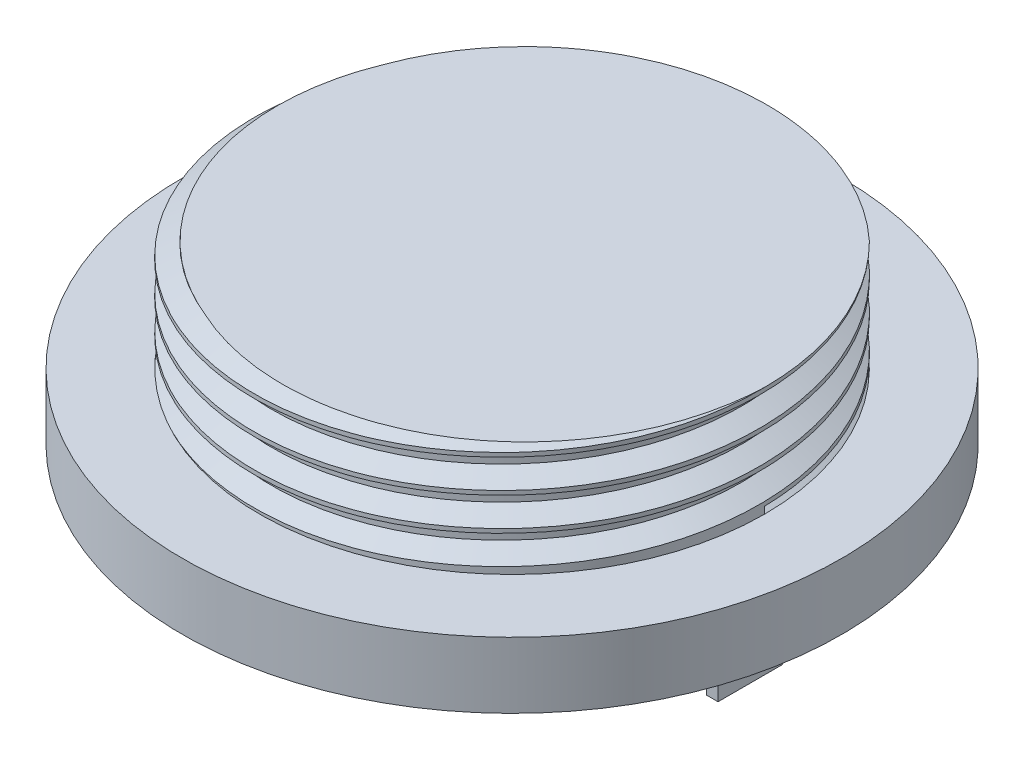
from build123d import *

# Parameters (mm, degrees)
ROSCA1_PITCH            = 1.5
SALIENTE_EXTRUIR1_DEPTH = 2


with BuildPart() as part:
    # Croquis1 → Revolución1 (revolve)
    with BuildSketch(Plane.XY, mode=Mode.PRIVATE) as revoluci_n1_sk:
        Polygon((0, 0), (-11.5, 0), (-11.5, -5), (-15, -5), (-15, -8), (0, -8), align=None)
    revolve(revoluci_n1_sk.sketch.rotate(Axis((0, -8, 0), (0, 1, 0)), 270), axis=Axis((0, -8, 0), (0, 1, 0)))

    # Rosca1: arcs per turn and ends read off the stored shape
    # Rosca1: the profile of Perfil de rosca1 profile screwed along a right-hand helix through 4 turns, 8 arcs to a turn; built about Z, then put on its axis
    rosca1_z = Axis((0, 0, 0), (0, 0, 1))
    rosca1_corners = [(11.5003, 0, -6.000173205), (11.5003, 0, -4.687326799), (10.688101187, 0, -5.156250002), (10.688101187, 0, -5.531250002)]
    with BuildLine(mode=Mode.PRIVATE) as rosca1_profile:
        Line(rosca1_corners[0], rosca1_corners[1])
        Line(rosca1_corners[1], rosca1_corners[2])
        Line(rosca1_corners[2], rosca1_corners[3])
        Line(rosca1_corners[3], rosca1_corners[0])
    rosca1_cap = Face(rosca1_profile.wire())
    rosca1_turn_angles = [0, 22.5, 45, 67.5, 90, 112.5, 135, 157.5, 180, 202.5, 225, 247.5, 270, 292.5, 315, 337.5, 360]
    rosca1_turn_weights = [1, 0.9238795325112867, 1, 0.9238795325112867, 1, 0.9238795325112867, 1, 0.9238795325112867, 1, 0.9238795325112867, 1, 0.9238795325112867, 1, 0.9238795325112867, 1, 0.9238795325112867, 1]
    rosca1_turn_rails = [Edge.make_bspline([Vector(p[0], p[1], 0).rotate(rosca1_z, rosca1_turn_angles[k]) / rosca1_turn_weights[k] + Vector(0, 0, p[2] + ROSCA1_PITCH * rosca1_turn_angles[k] / 360) for k in range(17)], [0, 0, 0, 1, 1, 2, 2, 3, 3, 4, 4, 5, 5, 6, 6, 7, 7, 8, 8, 8], 2, rosca1_turn_weights) for p in rosca1_corners]
    rosca1_turn_sides = [Face.make_surface_from_curves(rosca1_turn_rails[p[0]], rosca1_turn_rails[p[1]]) for p in [(0, 1), (1, 2), (2, 3), (3, 0)]]
    rosca1 = Plane(origin=(0, 0, 0), x_dir=(1, 0, 0), z_dir=(0, 1, 0)) * Solid(Shell([*[p.moved(Location((0, 0, ROSCA1_PITCH * i))) for i in range(4) for p in rosca1_turn_sides], rosca1_cap, rosca1_cap.rotate(rosca1_z, 1440).moved(Location((0, 0, ROSCA1_PITCH * 1440 / 360)))]))
    add(rosca1, mode=Mode.SUBTRACT)

    # Croquis4 → Saliente-Extruir1 (add)
    # profile 1 of 3: a face of its own
    with BuildSketch(Plane.XZ.offset(8)):
        with BuildLine():
            add(Edge.make_bspline(
                [(10.956503842, -6.005254355), (10.58780086, -6.199308556), (9.811856709, -5.768563764), (9.002753455, -5.571617792), (8.393819812, -5.354219577), (7.935493903, -5.19363361), (7.52067907, -5.165999151), (7.171987553, -5.159040487), (6.883861732, -5.498925025), (5.561331494, -6.348982973), (1.697830119, -7.917262619), (-3.462876257, -6.598952384), (-6.28590036, -3.209042971), (-8.240882907, 0.240350895), (-9.613556819, 3.229288355), (-10.599345379, 5.162346026)],
                knots=[0, 0, 0, 0, 0.045509031, 0.074889424, 0.092461381, 0.113663555, 0.12569481, 0.137175213, 0.14804311, 0.170270934, 0.305000949, 0.581101451, 0.650983707, 0.770099509, 1, 1, 1, 1], degree=3))
            add(Edge.make_bspline(
                [(-10.599345379, 5.162346026), (-9.231465535, 5.432474329), (-6.530023702, 5.508022369), (-1.060981598, 5.441982477), (4.575223582, 3.094614921), (7.36718164, -1.31970594), (8.055587124, -3.43828837), (7.794686735, -4.49416496), (8.203849604, -4.605717994), (8.565000776, -4.772953933), (9.118436531, -4.951296251), (9.913358399, -5.234957011), (11.011511279, -5.409340456), (10.956503842, -6.005254355)],
                knots=[0, 0, 0, 0, 0.154784951, 0.300688181, 0.611266062, 0.783841375, 0.856255033, 0.872092857, 0.881127578, 0.897547223, 0.918952342, 0.943746115, 1, 1, 1, 1], degree=3))
        make_face()
        with BuildLine():
            Line((7.003886937, -3.927477776), (5.613399008, -3.493767591))
            add(Edge.make_bspline(
                [(5.517503289, 0.126295811), (5.423569529, -0.521986953), (5.576388101, -1.726854958), (5.529476646, -2.937152341), (5.613399008, -3.493767591)],
                knots=[0, 0, 0, 0, 0.536589435, 1, 1, 1, 1], degree=3))
            add(Edge.make_bspline(
                [(7.003886937, -3.927477776), (7.089540708, -3.348044041), (6.958094789, -2.467698269), (6.335157535, -1.130677768), (5.853297578, -0.380433266), (5.517503289, 0.126295811)],
                knots=[0, 0, 0, 0, 0.395874286, 0.586576357, 1, 1, 1, 1], degree=3))
        make_face(mode=Mode.SUBTRACT)
        with BuildLine():
            add(Edge.make_bspline(
                [(6.394804764, -4.870429225), (5.937473497, -5.408955307), (4.623914586, -6.002734091), (3.274589993, -6.499184457), (2.519154827, -6.473045757)],
                knots=[0, 0, 0, 0, 0.481114359, 1, 1, 1, 1], degree=3))
            add(Edge.make_bspline(
                [(5.585334198, -4.509280819), (5.248197612, -4.699406888), (4.771244217, -5.073427234), (3.699926502, -5.650516611), (2.939367297, -6.009678765), (2.519154827, -6.473045757)],
                knots=[0, 0, 0, 0, 0.317739101, 0.494985422, 1, 1, 1, 1], degree=3))
            Line((5.585334198, -4.509280819), (6.394804764, -4.870429225))
        make_face(mode=Mode.SUBTRACT)
        with BuildLine():
            add(Edge.make_bspline(
                [(4.665250672, -4.114718742), (4.408888184, -4.475500518), (3.817963383, -4.838480602), (3.002108543, -5.411863739), (2.151126658, -5.800655772), (1.660574333, -6.271629973), (1.314871031, -6.40095856)],
                knots=[0, 0, 0, 0, 0.316444487, 0.507915907, 0.734242178, 1, 1, 1, 1], degree=3))
            add(Edge.make_bspline(
                [(1.314871031, -6.40095856), (0.550038283, -6.563786531), (-0.244892778, -6.432908819), (-0.975913201, -6.189294125)],
                knots=[0, 0, 0, 0, 1, 1, 1, 1], degree=3))
            add(Edge.make_bspline(
                [(-0.975913201, -6.189294125), (-0.62368355, -5.818841998), (0.024224486, -5.311361734), (0.976061635, -4.659200322), (1.862581632, -4.089766365), (2.4336117, -3.610841442), (2.787150335, -3.404318239)],
                knots=[0, 0, 0, 0, 0.326234019, 0.524999997, 0.738479425, 1, 1, 1, 1], degree=3))
            add(Edge.make_bspline(
                [(4.665250672, -4.114718742), (4.342359182, -4.033879717), (3.722526491, -3.778622151), (3.105298876, -3.519289948), (2.787150335, -3.404318239)],
                knots=[0, 0, 0, 0, 0.495129296, 1, 1, 1, 1], degree=3))
        make_face(mode=Mode.SUBTRACT)
        with BuildLine():
            add(Edge.make_bspline(
                [(4.892612697, -2.935865733), (4.320350004, -2.771645266), (3.770298155, -2.53986535), (3.229863692, -2.292387016)],
                knots=[0, 0, 0, 0, 1, 1, 1, 1], degree=3))
            add(Edge.make_bspline(
                [(3.229863692, -2.292387016), (3.242137772, -1.640703688), (2.968904192, -0.628895781), (2.882262515, 0.961647448), (2.761202132, 1.900636655), (2.787150335, 2.453912)],
                knots=[0, 0, 0, 0, 0.405945984, 0.652935856, 1, 1, 1, 1], degree=3))
            add(Edge.make_bspline(
                [(4.665250672, 0.744832528), (4.58798513, 1.10640377), (4.182603531, 1.484190036), (3.58669641, 2.132870374), (3.062036608, 2.294848511), (2.787150335, 2.453912)],
                knots=[0, 0, 0, 0, 0.397172812, 0.631474775, 1, 1, 1, 1], degree=3))
            add(Edge.make_bspline(
                [(4.892612697, -2.935865733), (4.859433459, -2.393835483), (4.801497202, -1.165918161), (4.727422279, 0.061280836), (4.665250672, 0.744832528)],
                knots=[0, 0, 0, 0, 0.44173337, 1, 1, 1, 1], degree=3))
        make_face(mode=Mode.SUBTRACT)
        with BuildLine():
            add(Edge.make_bspline(
                [(1.788471367, -2.935865733), (1.387401336, -3.250366602), (0.704365968, -3.759328134), (-0.144398574, -4.492781649), (-1.043372036, -4.977218913), (-1.495695001, -5.490313901), (-1.832225154, -5.715946469)],
                knots=[0, 0, 0, 0, 0.33454946, 0.559859208, 0.734193862, 1, 1, 1, 1], degree=3))
            add(Edge.make_bspline(
                [(-1.832225154, -5.715946469), (-2.279845826, -5.694800756), (-2.850192732, -5.213074007), (-3.52751923, -4.911084354), (-3.747118863, -4.675832183)],
                knots=[0, 0, 0, 0, 0.568617713, 1, 1, 1, 1], degree=3))
            add(Edge.make_bspline(
                [(-3.747118863, -4.675832183), (-3.406152545, -4.339296813), (-2.400899121, -3.22668591), (-1.106142243, -2.433864849), (-0.416783215, -1.685422272)],
                knots=[0, 0, 0, 0, 0.321357801, 1, 1, 1, 1], degree=3))
            add(Edge.make_bspline(
                [(1.788471367, -2.935865733), (1.432466447, -2.72877212), (0.607454899, -2.474202104), (-0.046274277, -1.908808413), (-0.416783215, -1.685422272)],
                knots=[0, 0, 0, 0, 0.486655124, 1, 1, 1, 1], degree=3))
        make_face(mode=Mode.SUBTRACT)
        with BuildLine():
            add(Edge.make_bspline(
                [(-1.473216958, -1.225024265), (-1.674758499, -1.685859799), (-2.285817388, -2.186022673), (-3.408170939, -3.002658892), (-3.874149464, -3.812653434), (-4.4185876, -4.114718742)],
                knots=[0, 0, 0, 0, 0.35060217, 0.56402103, 1, 1, 1, 1], degree=3))
            add(Edge.make_bspline(
                [(-4.4185876, -4.114718742), (-4.825691243, -3.849422749), (-5.216581624, -3.078537455), (-5.812789126, -2.465852802), (-6.013996697, -2.137062824)],
                knots=[0, 0, 0, 0, 0.548238925, 1, 1, 1, 1], degree=3))
            add(Edge.make_bspline(
                [(-6.013996697, -2.137062824), (-5.553192818, -1.842411561), (-4.906071037, -1.427666947), (-3.994891815, -0.733073295), (-3.45139975, -0.461876116), (-3.191349833, -0.181776825)],
                knots=[0, 0, 0, 0, 0.477747976, 0.669719662, 1, 1, 1, 1], degree=3))
            add(Edge.make_bspline(
                [(-1.473216958, -1.225024265), (-1.997361496, -0.791750417), (-2.698147633, -0.65860339), (-3.191349833, -0.181776825)],
                knots=[0, 0, 0, 0, 1, 1, 1, 1], degree=3))
        make_face(mode=Mode.SUBTRACT)
        with BuildLine():
            add(Edge.make_bspline(
                [(-6.389619307, -1.503524143), (-5.930624402, -1.05253252), (-5.043745097, -0.702057406), (-4.167478991, -0.086393925), (-4.043624248, 0.280881365)],
                knots=[0, 0, 0, 0, 0.616736789, 1, 1, 1, 1], degree=3))
            add(Edge.make_bspline(
                [(-4.043624248, 0.280881365), (-4.700816912, 0.917526939), (-5.647844759, 1.080371507), (-6.289982451, 1.738339763)],
                knots=[0, 0, 0, 0, 1, 1, 1, 1], degree=3))
            add(Edge.make_bspline(
                [(-7.7573616, 0.996455148), (-7.180564959, 1.04607635), (-6.900062357, 1.886920627), (-6.289982451, 1.738339763)],
                knots=[0, 0, 0, 0, 1, 1, 1, 1], degree=3))
            add(Edge.make_bspline(
                [(-6.389619307, -1.503524143), (-6.775816577, -1.065612023), (-7.030141966, -0.12774949), (-7.583972695, 0.65538744), (-7.7573616, 0.996455148)],
                knots=[0, 0, 0, 0, 0.597561688, 1, 1, 1, 1], degree=3))
        make_face(mode=Mode.SUBTRACT)
        with BuildLine():
            add(Edge.make_bspline(
                [(-7.096135193, 2.294329278), (-7.287648412, 2.219604633), (-7.851881198, 1.452707489), (-8.335320731, 2.025183275), (-8.664097918, 2.741594725), (-9.021176271, 3.392198095), (-9.260972332, 3.849692381)],
                knots=[0, 0, 0, 0, 0.310867916, 0.394957503, 0.558356504, 1, 1, 1, 1], degree=3))
            add(Edge.make_bspline(
                [(-7.096135193, 2.294329278), (-7.39447143, 2.575296188), (-8.095340168, 3.124343022), (-8.801857387, 3.678885073), (-9.260972332, 3.849692381)],
                knots=[0, 0, 0, 0, 0.458358468, 1, 1, 1, 1], degree=3))
        make_face(mode=Mode.SUBTRACT)
        with BuildLine():
            add(Edge.make_bspline(
                [(-6.914977274, 3.396797582), (-6.889228371, 3.739299609), (-6.935087543, 4.077332457), (-6.896039836, 4.774494309), (-7.30475571, 4.763684961), (-7.657687753, 4.846151236), (-8.30034495, 4.773576113), (-8.785052221, 4.947647538), (-9.125103892, 4.837003043)],
                knots=[0, 0, 0, 0, 0.268264531, 0.385213078, 0.459278609, 0.566833805, 0.712658108, 1, 1, 1, 1], degree=3))
            add(Edge.make_bspline(
                [(-6.914977274, 3.396797582), (-7.325175138, 3.643456337), (-8.086744713, 4.089703483), (-8.760803185, 4.661377702), (-9.125103892, 4.837003043)],
                knots=[0, 0, 0, 0, 0.544609427, 1, 1, 1, 1], degree=3))
        make_face(mode=Mode.SUBTRACT)
        with BuildLine():
            add(Edge.make_bspline(
                [(-3.814260966, 1.418580435), (-4.273521809, 1.566739196), (-4.752152461, 2.080152939), (-5.629293315, 2.338650258), (-5.914512445, 2.946782629), (-6.036501966, 3.716115748), (-6.123230011, 4.345632196), (-6.123266906, 4.728308291)],
                knots=[0, 0, 0, 0, 0.312979463, 0.470055147, 0.574113789, 0.74198976, 1, 1, 1, 1], degree=3))
            add(Edge.make_bspline(
                [(-3.814260966, 1.418580435), (-4.004547653, 1.958984752), (-3.913711388, 2.752426965), (-4.217548553, 3.719333336), (-4.403808452, 4.208397289), (-4.488187245, 4.673752258), (-5.181408909, 4.814617754), (-5.652053598, 4.656174357), (-6.123266906, 4.728308291)],
                knots=[0, 0, 0, 0, 0.341457352, 0.475560879, 0.607155055, 0.678259428, 0.727850671, 1, 1, 1, 1], degree=3))
        make_face(mode=Mode.SUBTRACT)
        with BuildLine():
            add(Edge.make_bspline(
                [(-1.349776124, 0), (-1.714655221, 0.198801959), (-2.198815544, 0.407513657), (-2.77790512, 0.801477395), (-3.048632506, 1.344534412), (-3.226037657, 2.071583524), (-3.198568567, 3.229558454), (-3.654350854, 3.987801111), (-3.655948095, 4.547150372)],
                knots=[0, 0, 0, 0, 0.225465408, 0.29156805, 0.375328035, 0.547817357, 0.698545178, 1, 1, 1, 1], degree=3))
            add(Edge.make_bspline(
                [(-1.349776124, 0), (-1.351599078, 0.549711442), (-1.692219173, 1.334223565), (-1.730976735, 2.430907135), (-1.910230574, 3.241266379), (-1.991052341, 3.835175365), (-2.050373668, 4.42849918), (-2.824625362, 4.467995433), (-3.229838619, 4.627303859), (-3.655948095, 4.547150372)],
                knots=[0, 0, 0, 0, 0.271622479, 0.416102507, 0.548394434, 0.680552673, 0.734695834, 0.811446838, 1, 1, 1, 1], degree=3))
        make_face(mode=Mode.SUBTRACT)
        with BuildLine():
            add(Edge.make_bspline(
                [(2.226036894, -1.685422272), (1.805972732, -1.542598839), (1.091084172, -1.36293383), (0.325548588, -0.820827082), (-0.322052404, -0.642927889), (-0.681464079, 0.065994841), (-0.655517465, 0.951566577), (-1.022492022, 2.326958376), (-0.941638728, 3.363761807), (-1.141647084, 4.017299416)],
                knots=[0, 0, 0, 0, 0.180624549, 0.286973248, 0.379070055, 0.431350089, 0.590975992, 0.729093622, 1, 1, 1, 1], degree=3))
            add(Edge.make_bspline(
                [(2.226036894, -1.685422272), (2.250440318, -1.118816388), (2.142327759, -0.233345146), (2.038501427, 1.07584496), (1.810027091, 2.043768172), (1.984820065, 3.017368358), (1.365439321, 3.390834292), (0.792807838, 3.608326344), (-0.098592199, 3.793019189), (-0.705492084, 4.123391857), (-1.141647084, 4.017299416)],
                knots=[0, 0, 0, 0, 0.213489292, 0.340134324, 0.492638803, 0.605070801, 0.657073496, 0.74688571, 0.84183989, 1, 1, 1, 1], degree=3))
        make_face(mode=Mode.SUBTRACT)
    # profile 2 of 3: a face of its own
    with BuildSketch(Plane.XZ.offset(8)):
        Polygon((8.561958494, -2.095176838), (12.307441379, -2.095176838), (12.307441379, -0.040442465), (12.834802938, -0.040442465), (12.834802938, -2.985004482), (8.561958494, -2.985004482), align=None)
    # profile 3 of 3: a face of its own
    with BuildSketch(Plane.XZ.offset(8)):
        Polygon((8.561958494, 1.40638233), (12.307441379, 1.40638233), (12.307441379, 3.461116703), (12.834802938, 3.461116703), (12.834802938, 0.516554686), (8.561958494, 0.516554686), align=None)
    extrude(amount=SALIENTE_EXTRUIR1_DEPTH)


solid = part.part
